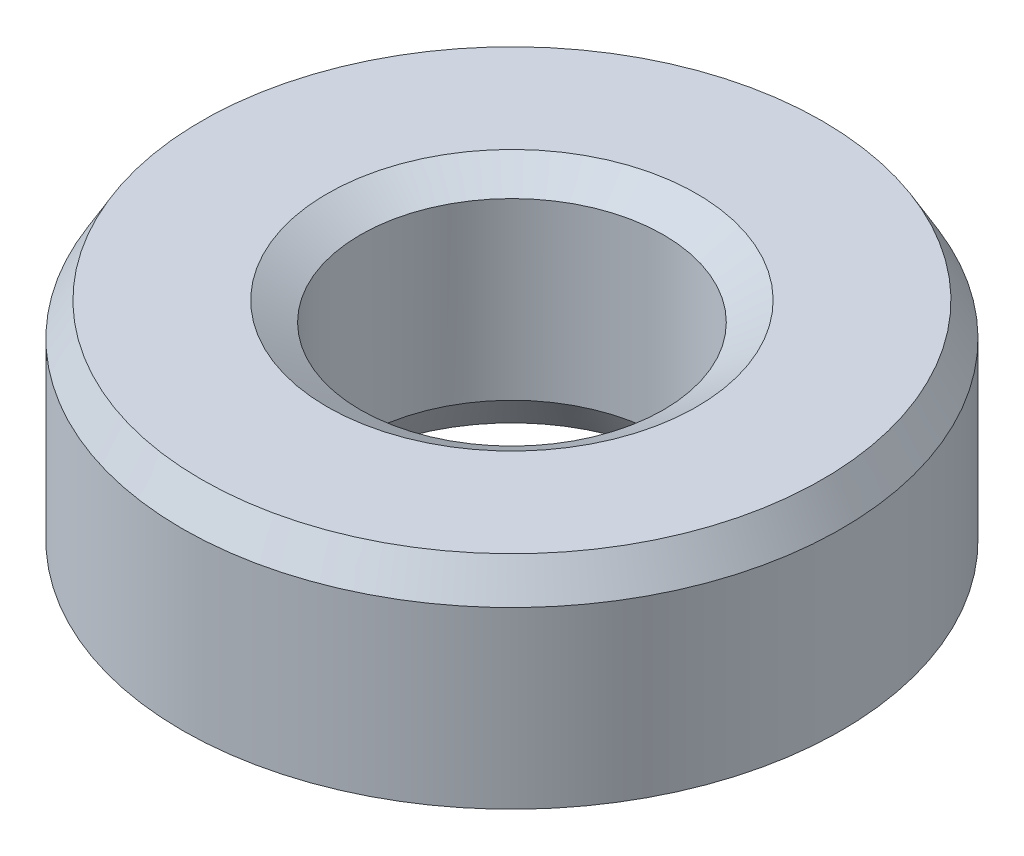
from build123d import *
from OCP.BRepFilletAPI import BRepFilletAPI_MakeChamfer

# Parameters (mm, degrees)
SKETCH1_R           = 17.5
BOSS_EXTRUDE1_DEPTH = 12.048795033
SKETCH2_R           = 8.049872035
CUT_EXTRUDE1_DEPTH  = 28.525868955
CHAMFER1_SIZE       = 1.758551133
CHAMFER1_SIZE2      = 1.01529997


with BuildPart() as part:
    # Sketch1 → Boss-Extrude1 (new body)
    with BuildSketch(Plane(origin=(0, 0, 0), x_dir=(1, 0, 0), z_dir=(0, 1, 0))):
        Circle(SKETCH1_R)
    extrude(amount=BOSS_EXTRUDE1_DEPTH)

    # Sketch2 → Cut-Extrude1 (cut, through all)
    with BuildSketch(Plane(origin=(0, 0, 0), x_dir=(1, 0, 0), z_dir=(0, 1, 0))):
        Circle(SKETCH2_R)
    extrude(amount=CUT_EXTRUDE1_DEPTH, mode=Mode.SUBTRACT)

    # Chamfer1: one chamfer whose edges measure the first distance from different faces: ONE call of the kernel's chamfer builder (chamfer() names one face for all edges)
    chamfer1_edges_1 = [part.edges().sort_by_distance(p)[0] for p in [
        (-8.049872035, 12.048795033, 0),
    ]]
    chamfer1_side_1 = [part.faces().sort_by_distance(p)[0] for p in [
        (-17.005025253, 12.048795033, 0),
    ]]
    chamfer1_edges_2 = [part.edges().sort_by_distance(p)[0] for p in [
        (-8.049872035, 0, 0),
    ]]
    chamfer1_side_2 = [part.faces().sort_by_distance(p)[0] for p in [
        (-8.049872035, 6.024397517, 0),
    ]]
    chamfer1_edges_3 = [part.edges().sort_by_distance(p)[0] for p in [
        (-17.5, 0, 0),
    ]]
    chamfer1_side_3 = [part.faces().sort_by_distance(p)[0] for p in [
        (-17.005025253, 0, 0),
    ]]
    chamfer1_edges_4 = [part.edges().sort_by_distance(p)[0] for p in [
        (-17.5, 12.048795033, 0),
    ]]
    chamfer1_side_4 = [part.faces().sort_by_distance(p)[0] for p in [
        (-17.5, 6.024397517, 0),
    ]]
    chamfer1 = BRepFilletAPI_MakeChamfer(part.part.solid().wrapped)
    for e in chamfer1_edges_1:
        chamfer1.Add(CHAMFER1_SIZE, CHAMFER1_SIZE2, e.wrapped, chamfer1_side_1[0].wrapped)  # the first distance lies on this face
    for e in chamfer1_edges_2:
        chamfer1.Add(CHAMFER1_SIZE, CHAMFER1_SIZE2, e.wrapped, chamfer1_side_2[0].wrapped)  # the first distance lies on this face
    for e in chamfer1_edges_3:
        chamfer1.Add(CHAMFER1_SIZE, CHAMFER1_SIZE2, e.wrapped, chamfer1_side_3[0].wrapped)  # the first distance lies on this face
    for e in chamfer1_edges_4:
        chamfer1.Add(CHAMFER1_SIZE, CHAMFER1_SIZE2, e.wrapped, chamfer1_side_4[0].wrapped)  # the first distance lies on this face
    add(Compound.cast(chamfer1.Shape()), mode=Mode.REPLACE)


solid = part.part
